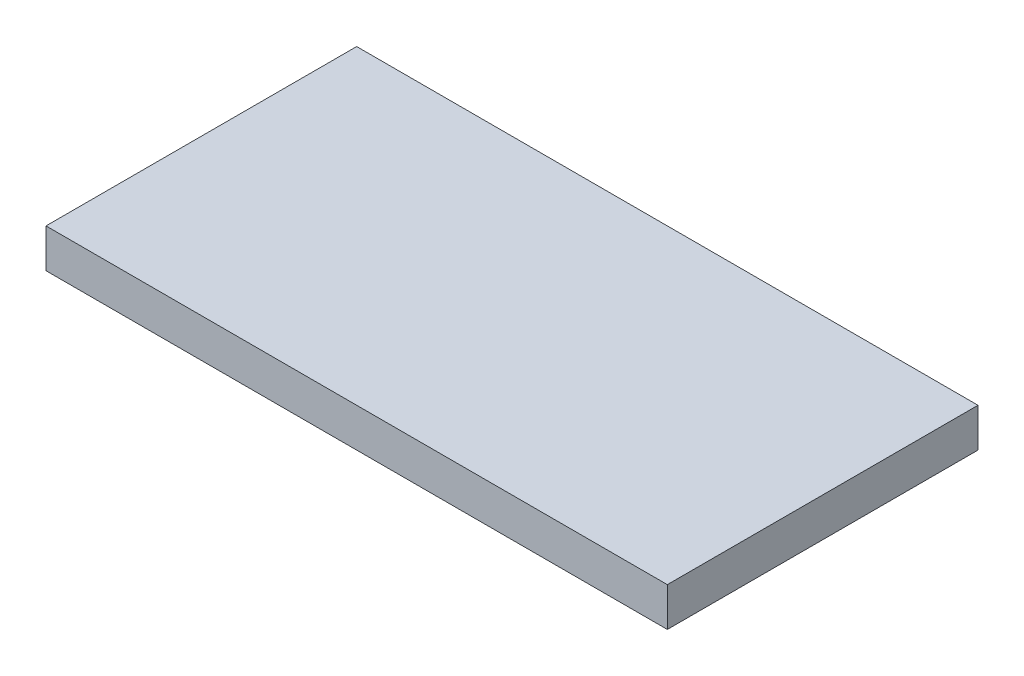
from build123d import *

# Parameters (mm, degrees)
SKETCH1_W           = 320
SKETCH1_H           = 160
BOSS_EXTRUDE1_DEPTH = 20


with BuildPart() as part:
    # Sketch1 → Boss-Extrude1 (new body)
    with BuildSketch(Plane(origin=(0, 0, 0), x_dir=(1, 0, 0), z_dir=(0, 1, 0))):
        Rectangle(SKETCH1_W, SKETCH1_H)
    extrude(amount=BOSS_EXTRUDE1_DEPTH)


solid = part.part
